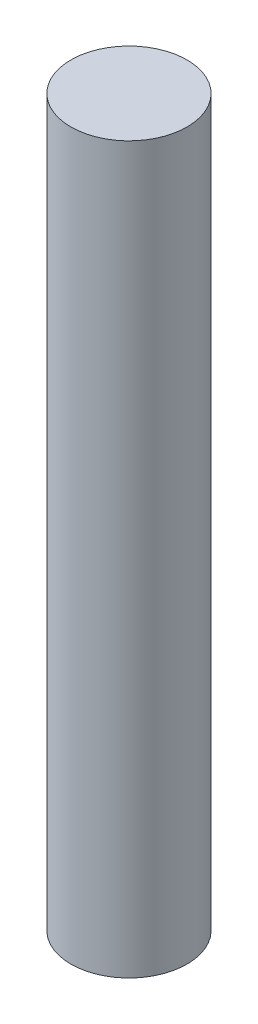
from build123d import *

# Parameters (mm, degrees)
SKETCH1_R           = 3.175
BOSS_EXTRUDE1_DEPTH = 39.624


with BuildPart() as part:
    # Sketch1 → Boss-Extrude1 (new body)
    with BuildSketch(Plane(origin=(0, 0, 0), x_dir=(1, 0, 0), z_dir=(0, 1, 0))):
        Circle(SKETCH1_R)
    extrude(amount=BOSS_EXTRUDE1_DEPTH)


solid = part.part
